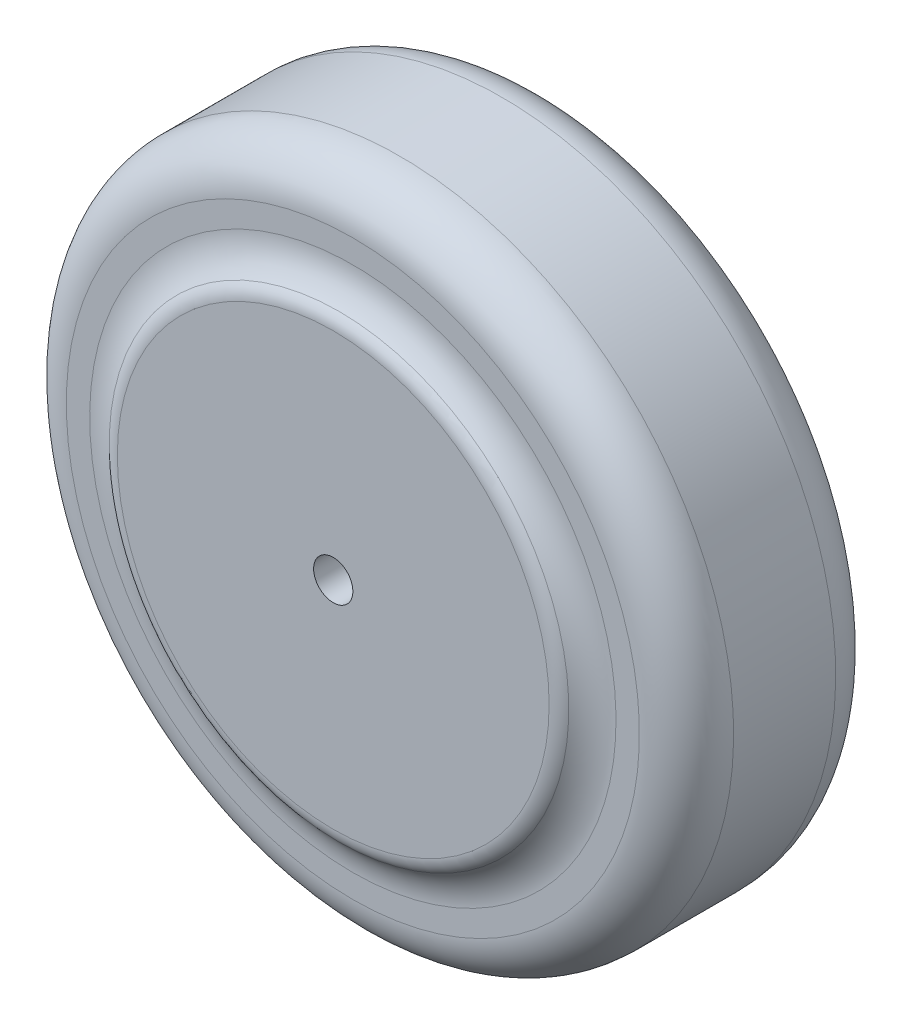
from build123d import *

# Parameters (mm, degrees)
SKETCH2_R             = 85
BOSS_EXTRUDE1_DEPTH   = 50
SKETCH3_R             = 60
BOSS_EXTRUDE2_DEPTH   = 5
BOSS_EXTRUDE3_START   = 5
SKETCH4_R             = 60
BOSS_EXTRUDE3_DEPTH   = 5
SKETCH5_R             = 5
CUT_EXTRUDE1_DEPTH    = 100
BODY_MOVE_COPY1_ANGLE = 90
FILLET1_R             = 5
FILLET2_R             = 12


with BuildPart() as part:
    # Sketch2 → Boss-Extrude1 (new body)
    with BuildSketch(Plane(origin=(0, 0, 0), x_dir=(1, 0, 0), z_dir=(0, 1, 0))):
        with Locations(Location((0, 0, 0), (0, 0, 270))):
            Circle(SKETCH2_R)
    extrude(amount=BOSS_EXTRUDE1_DEPTH)

    # Sketch3 → Boss-Extrude2 (add)
    with BuildSketch(Plane(origin=(0, 50, 0), x_dir=(1, 0, 0), z_dir=(0, 1, 0))):
        with Locations(Location((0, 0, 0), (0, 0, 270))):
            Circle(SKETCH3_R)
    extrude(amount=BOSS_EXTRUDE2_DEPTH)

    # Sketch4 → Boss-Extrude3 (add)
    with BuildSketch(Plane.XZ.offset(BOSS_EXTRUDE3_START)):
        with Locations(Location((0, 0, 0), (0, 0, 90))):
            Circle(SKETCH4_R)
    extrude(amount=-BOSS_EXTRUDE3_DEPTH)

    # Sketch5 → Cut-Extrude1 (cut)
    with BuildSketch(Plane(origin=(0, 55, 0), x_dir=(1, 0, 0), z_dir=(0, 1, 0))):
        with Locations(Location((0, 0, 0), (0, 0, 270))):
            Circle(SKETCH5_R)
    extrude(amount=-CUT_EXTRUDE1_DEPTH, mode=Mode.SUBTRACT)


with BuildPart() as part_1:
    # Body-Move/Copy1: moved
    add(part.part.rotate(Axis((0, 10, 0), (1, 0, 0)), BODY_MOVE_COPY1_ANGLE))

    # Fillet1
    fillet1_edges = [part_1.edges().sort_by_distance(p)[0] for p in [
        (0, 70, -15),
        (0, 70, 45),
    ]]
    fillet(fillet1_edges, radius=FILLET1_R - 0.0001)  # a hair under: the kernel refuses the full size

    # Fillet2
    fillet2_edges = [part_1.edges().sort_by_distance(p)[0] for p in [
        (0, 95, -10),
        (0, 95, 40),
        (0, 70, 40),
    ]]
    fillet(fillet2_edges, radius=FILLET2_R)


solid = part_1.part
